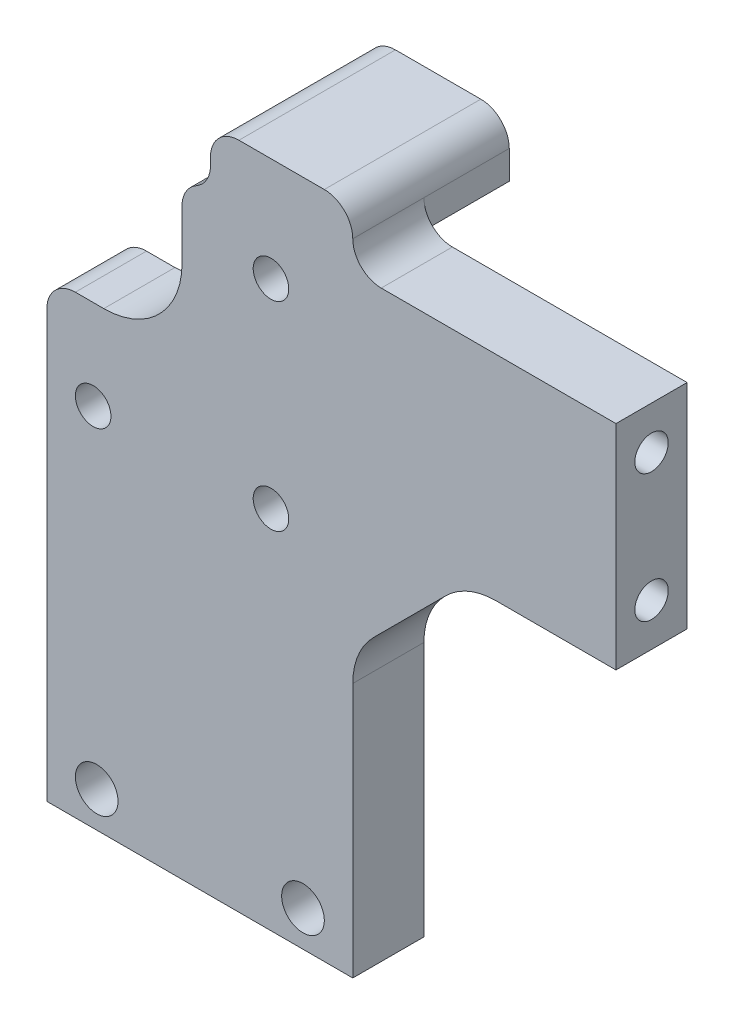
from build123d import *

# Parameters (mm, degrees)
SKETCH1_W           = 21.5
SKETCH1_H           = 43
BOSS_EXTRUDE1_DEPTH = 5
CUT_EXTRUDE1_DEPTH  = 5
SKETCH7_W           = 18.5
SKETCH7_H           = 15
BOSS_EXTRUDE2_DEPTH = 5
SKETCH8_R           = 1.175
CUT_EXTRUDE4_DEPTH  = 8
CUT_EXTRUDE5_REACH  = 38.644
SKETCH11_R          = 1.25
CUT_EXTRUDE6_REACH  = 38.644
SKETCH3_R           = 1.5
SKETCH12_R          = 2.25
CUT_EXTRUDE7_DEPTH  = 2
CHAMFER1_SIZE       = 8
CUT_EXTRUDE8_REACH  = 38.644
FILLET4_R           = 2
FILLET5_R           = 5
SKETCH17_W          = 10
SKETCH17_H          = 4
BOSS_EXTRUDE3_DEPTH = 11
FILLET6_R           = 2


with BuildPart() as part:
    # Sketch1 → Boss-Extrude1 (new body)
    with BuildSketch(Plane.XY):
        Rectangle(SKETCH1_W, SKETCH1_H)
    extrude(amount=BOSS_EXTRUDE1_DEPTH)

    # Sketch2 → Cut-Extrude1 (cut)
    with BuildSketch(Plane.XY.offset(5)):
        with BuildLine():
            Line((-6.75, 12.499561173), (-10.75, 12.499561173))
            Line((-10.75, 12.499561173), (-10.75, 21.5))
            Line((-10.75, 21.5), (-3.25, 21.5))
            Line((-3.25, 21.5), (-3.25, 15.944574555))
            ThreePointArc((-3.25, 15.944574555), (-4.294490012, 13.505297076), (-6.75, 12.499561173))
        make_face()
    extrude(amount=-CUT_EXTRUDE1_DEPTH, mode=Mode.SUBTRACT)

    # Sketch7 → Boss-Extrude2 (add)
    with BuildSketch(Plane.XY.offset(5)):
        with Locations((20, 14)):
            Rectangle(SKETCH7_W, SKETCH7_H)
    extrude(amount=-BOSS_EXTRUDE2_DEPTH)

    # Sketch8 → Cut-Extrude4 (cut)
    with BuildSketch(Plane(origin=(29.25, 0, 0), x_dir=(0, 0, -1), z_dir=(1, 0, 0))):
        with Locations((-2.5, 9.5)):
            Circle(SKETCH8_R)
        with Locations((-2.5, 18.5)):
            Circle(SKETCH8_R)
    extrude(amount=-CUT_EXTRUDE4_DEPTH, mode=Mode.SUBTRACT)

    # Sketch11 → Cut-Extrude5 (cut, up to next)
    with BuildSketch(Plane.XY.offset(5), mode=Mode.PRIVATE) as cut_extrude5_sk1:
        with Locations((5, 4.194574555)):
            Circle(SKETCH11_R)
    cut_extrude5_tool1 = extrude(cut_extrude5_sk1.sketch, amount=-CUT_EXTRUDE5_REACH, mode=Mode.PRIVATE) & part.part
    # Sketch11 → Cut-Extrude5 (cut, up to next)
    with BuildSketch(Plane.XY.offset(5), mode=Mode.PRIVATE) as cut_extrude5_sk2:
        with Locations((-7.5, 4.194574555)):
            Circle(SKETCH11_R)
    cut_extrude5_tool2 = extrude(cut_extrude5_sk2.sketch, amount=-CUT_EXTRUDE5_REACH, mode=Mode.PRIVATE) & part.part
    # Sketch11 → Cut-Extrude5 (cut, up to next)
    with BuildSketch(Plane.XY.offset(5), mode=Mode.PRIVATE) as cut_extrude5_sk3:
        with Locations((5, 18.194574555)):
            Circle(SKETCH11_R)
    cut_extrude5_tool3 = extrude(cut_extrude5_sk3.sketch, amount=-CUT_EXTRUDE5_REACH, mode=Mode.PRIVATE) & part.part
    add(cut_extrude5_tool1.solids().sort_by_distance((5, 4.194575, 5))[0], mode=Mode.SUBTRACT)
    add(cut_extrude5_tool2.solids().sort_by_distance((-7.5, 4.194575, 5))[0], mode=Mode.SUBTRACT)
    add(cut_extrude5_tool3.solids().sort_by_distance((5, 18.194575, 5))[0], mode=Mode.SUBTRACT)

    # Sketch3 → Cut-Extrude6 (cut, up to next)
    with BuildSketch(Plane.XY.offset(5), mode=Mode.PRIVATE) as cut_extrude6_sk1:
        with Locations((-7.25, -19)):
            Circle(SKETCH3_R)
    cut_extrude6_tool1 = extrude(cut_extrude6_sk1.sketch, amount=-CUT_EXTRUDE6_REACH, mode=Mode.PRIVATE) & part.part
    # Sketch3 → Cut-Extrude6 (cut, up to next)
    with BuildSketch(Plane.XY.offset(5), mode=Mode.PRIVATE) as cut_extrude6_sk2:
        with Locations((7.25, -19)):
            Circle(SKETCH3_R)
    cut_extrude6_tool2 = extrude(cut_extrude6_sk2.sketch, amount=-CUT_EXTRUDE6_REACH, mode=Mode.PRIVATE) & part.part
    add(cut_extrude6_tool1.solids().sort_by_distance((-7.25, -19, 5))[0], mode=Mode.SUBTRACT)
    add(cut_extrude6_tool2.solids().sort_by_distance((7.25, -19, 5))[0], mode=Mode.SUBTRACT)

    # Sketch12 → Cut-Extrude7 (cut)
    with BuildSketch(Plane(origin=(0, 0, 0), x_dir=(-1, 0, 0), z_dir=(0, 0, -1))):
        with Locations((-5, 4.194574555)):
            Circle(SKETCH12_R)
        with Locations((-5, 18.194574555)):
            Circle(SKETCH12_R)
        with Locations((7.5, 4.194574555)):
            Circle(SKETCH12_R)
    extrude(amount=-CUT_EXTRUDE7_DEPTH, mode=Mode.SUBTRACT)

    # Chamfer1
    chamfer1_edges = [part.edges().sort_by_distance(p)[0] for p in [
        (10.75, 6.5, 2.5),
    ]]
    chamfer(chamfer1_edges, length=CHAMFER1_SIZE)

    # Sketch14 → Cut-Extrude8 (cut, up to next)
    with BuildSketch(Plane.XY.offset(5), mode=Mode.PRIVATE) as cut_extrude8_sk1:
        with BuildLine():
            Line((-10.75, 10.5), (-6.75, 10.5))
            ThreePointArc((-6.75, 10.5), (-2.860912703, 12.110912703), (-1.25, 16))
            Line((-1.25, 16), (-1.25, 21.5))
            Line((-1.25, 21.5), (-10.75, 21.5))
            Line((-10.75, 21.5), (-10.75, 10.5))
        make_face()
    cut_extrude8_tool1 = extrude(cut_extrude8_sk1.sketch, amount=-CUT_EXTRUDE8_REACH, mode=Mode.PRIVATE) & part.part
    add(cut_extrude8_tool1.solids().sort_by_distance((-6.23325, 16.282927, 5))[0], mode=Mode.SUBTRACT)

    # Fillet4
    fillet4_edges = [part.edges().sort_by_distance(p)[0] for p in [
        (-1.25, 21.5, 2.5),
        (-10.75, 10.5, 2.5),
    ]]
    fillet(fillet4_edges, radius=FILLET4_R)

    # Fillet5
    fillet5_edges = [part.edges().sort_by_distance(p)[0] for p in [
        (18.75, 6.5, 2.5),
        (10.75, -1.5, 2.5),
    ]]
    fillet(fillet5_edges, radius=FILLET5_R)

    # Sketch17 → Boss-Extrude3 (add)
    with BuildSketch(Plane.XY.offset(5)):
        with Locations((5.75, 23.5)):
            Rectangle(SKETCH17_W, SKETCH17_H)
    extrude(amount=-BOSS_EXTRUDE3_DEPTH)

    # Fillet6
    fillet6_edges = [part.edges().sort_by_distance(p)[0] for p in [
        (0.75, 21.5, 2.5),
        (10.75, 21.5, 2.5),
        (10.75, 25.5, -0.5),
        (0.75, 25.5, -0.5),
    ]]
    fillet(fillet6_edges, radius=FILLET6_R - 0.0001)  # a hair under: the kernel refuses the full size


solid = part.part
